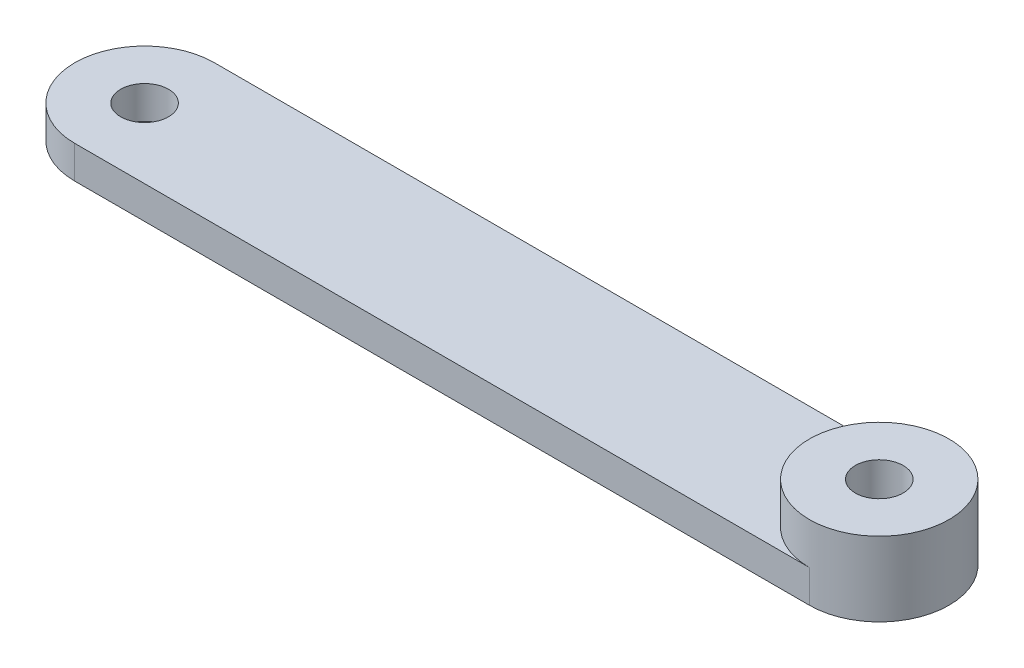
from build123d import *

# Parameters (mm, degrees)
BOSS_EXTRUDE1_DEPTH = 2.975
SKETCH2_R           = 2.175
CUT_EXTRUDE1_DEPTH  = 12.7
SKETCH3_R           = 2.175
BOSS_EXTRUDE2_DEPTH = 3.775


with BuildPart() as part:
    # Sketch1 → Boss-Extrude1 (new body)
    with BuildSketch(Plane(origin=(0, 0, 0), x_dir=(1, 0, 0), z_dir=(0, 1, 0))):
        with BuildLine():
            Line((-23.171929825, 5.625877193), (43.628070175, 5.625877193))
            ThreePointArc((43.628070175, 5.625877193), (49.978070175, -0.724122807), (43.628070175, -7.074122807))
            Line((43.628070175, -7.074122807), (-23.171929825, -7.074122807))
            ThreePointArc((-23.171929825, -7.074122807), (-29.521929825, -0.724122807), (-23.171929825, 5.625877193))
        make_face()
    extrude(amount=BOSS_EXTRUDE1_DEPTH)

    # Sketch2 → Cut-Extrude1 (cut)
    with BuildSketch(Plane(origin=(0, 2.975, 0), x_dir=(1, 0, 0), z_dir=(0, 1, 0))):
        with Locations((-23.171929825, -0.724122807)):
            Circle(SKETCH2_R)
        with Locations((43.628070175, -0.724122807)):
            Circle(SKETCH2_R)
    extrude(amount=-CUT_EXTRUDE1_DEPTH, mode=Mode.SUBTRACT)

    # Sketch3 → Boss-Extrude2 (add)
    with BuildSketch(Plane(origin=(0, 2.975, 0), x_dir=(1, 0, 0), z_dir=(0, 1, 0))):
        with BuildLine():
            ThreePointArc((43.628070175, 5.625877193), (49.978070175, -0.724122807), (43.628070175, -7.074122807))
            ThreePointArc((43.628070175, -7.074122807), (37.278070175, -0.724122807), (43.628070175, 5.625877193))
        make_face()
        with Locations((43.628070175, -0.724122807)):
            Circle(SKETCH3_R, mode=Mode.SUBTRACT)
    extrude(amount=BOSS_EXTRUDE2_DEPTH)


solid = part.part
